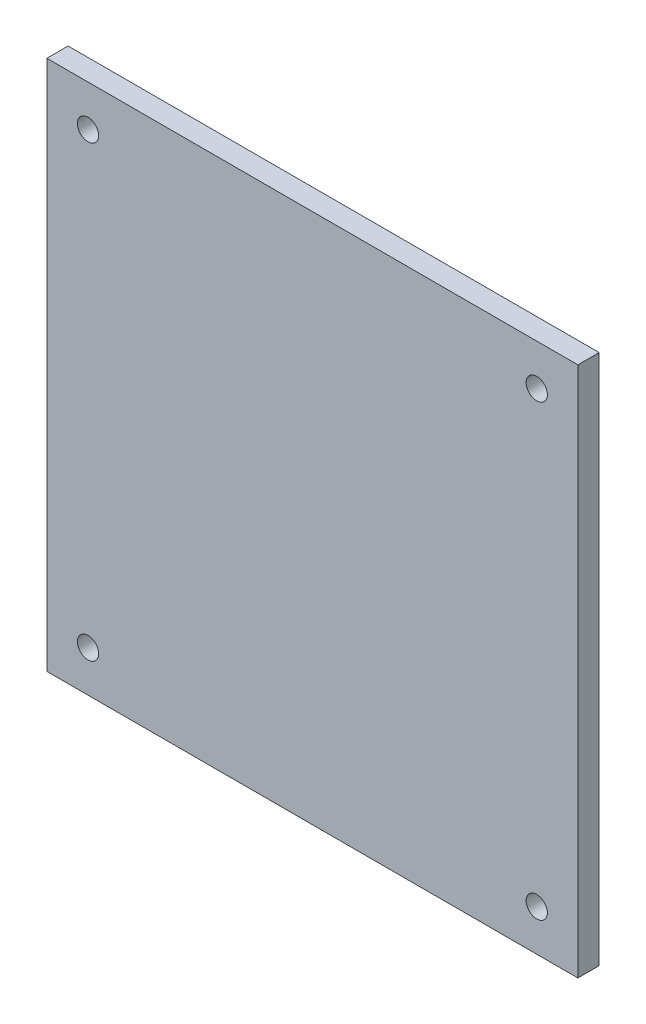
from build123d import *

# Parameters (mm, degrees)
SKETCH2_W          = 100
SKETCH2_H          = 100
SKETCH2_R          = 2
BASE_FLANGE2_DEPTH = 4


# Sheet-metal steps are written as plain solids
with BuildPart() as part:
    # Sketch2 → Base-Flange2 (new body)
    with BuildSketch(Plane.XY):
        with Locations((155.866052122, 51.228344263)):
            Rectangle(SKETCH2_W, SKETCH2_H)
        with Locations((113.616052122, 93.478344263)):
            Circle(SKETCH2_R, mode=Mode.SUBTRACT)
        with Locations((198.116052122, 93.478344263)):
            Circle(SKETCH2_R, mode=Mode.SUBTRACT)
        with Locations((198.116052122, 8.978344263)):
            Circle(SKETCH2_R, mode=Mode.SUBTRACT)
        with Locations((113.616052122, 8.978344263)):
            Circle(SKETCH2_R, mode=Mode.SUBTRACT)
    extrude(amount=-BASE_FLANGE2_DEPTH)


solid = part.part
